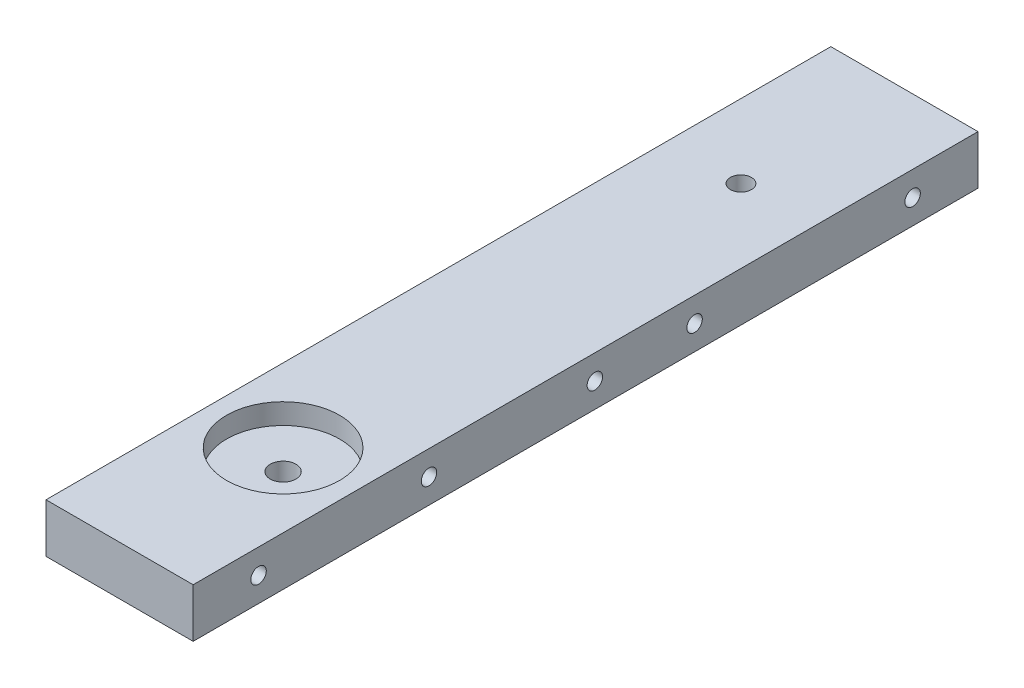
from build123d import *

# Parameters (mm, degrees)
SKETCH2_W             = 28.575
SKETCH2_H             = 152.4
BOSS_EXTRUDE1_DEPTH   = 9.525
F_3_0MM_DOWEL_HOLE1_D = 3
LPATTERN1_COUNT       = 4
LPATTERN1_PITCH       = 42.333333333
F_3_0MM_DOWEL_HOLE2_D = 3
SKETCH12_R            = 2.05
CUT_EXTRUDE1_DEPTH    = 156.348048749
SKETCH12_4_R          = 10.975
CUT_EXTRUDE2_DEPTH    = 4
SKETCH15_R            = 2.5
CUT_EXTRUDE3_DEPTH    = 156.154169296


with BuildPart() as part:
    # Sketch2 → Boss-Extrude1 (new body)
    with BuildSketch(Plane(origin=(0, 0, 0), x_dir=(1, 0, 0), z_dir=(0, 1, 0))):
        with Locations((14.2875, 76.2)):
            Rectangle(SKETCH2_W, SKETCH2_H)
    extrude(amount=BOSS_EXTRUDE1_DEPTH)

    # Ø3.0mm Dowel Hole1 (through all)
    with Locations(Plane.ZY):
        with Locations((-139.7, 4.7625)):
            f_3_0mm_dowel_hole1 = Hole(F_3_0MM_DOWEL_HOLE1_D / 2)

    # LPattern1: Ø3.0mm Dowel Hole1 ×4, 1 skipped
    with Locations(*[(0, 0, i * LPATTERN1_PITCH) for i in range(1, LPATTERN1_COUNT) if i not in (2,)]):
        add(f_3_0mm_dowel_hole1, mode=Mode.SUBTRACT)

    # Ø3.0mm Dowel Hole2 (through all)
    with Locations(Plane.ZY):
        with Locations((-78, 4.7625), (-45.79, 4.7625)):
            Hole(F_3_0MM_DOWEL_HOLE2_D / 2)

    # Sketch12 → Cut-Extrude1 (cut, through all)
    with BuildSketch(Plane(origin=(0, 9.525, 0), x_dir=(1, 0, 0), z_dir=(0, 1, 0))):
        with Locations((14.2875, 120.65)):
            Circle(SKETCH12_R)
    extrude(amount=-CUT_EXTRUDE1_DEPTH, mode=Mode.SUBTRACT)

    # Sketch12<4> → Cut-Extrude2 (cut)
    with BuildSketch(Plane(origin=(0, 9.525, 0), x_dir=(1, 0, 0), z_dir=(0, 1, 0))):
        with Locations((14.2875, 31.75)):
            Circle(SKETCH12_4_R)
    extrude(amount=-CUT_EXTRUDE2_DEPTH, mode=Mode.SUBTRACT)

    # Sketch15 → Cut-Extrude3 (cut, through all)
    with BuildSketch(Plane(origin=(0, 5.525, 0), x_dir=(1, 0, 0), z_dir=(0, 1, 0))):
        with Locations((14.2875, 31.75)):
            Circle(SKETCH15_R)
    extrude(amount=-CUT_EXTRUDE3_DEPTH, mode=Mode.SUBTRACT)


solid = part.part
